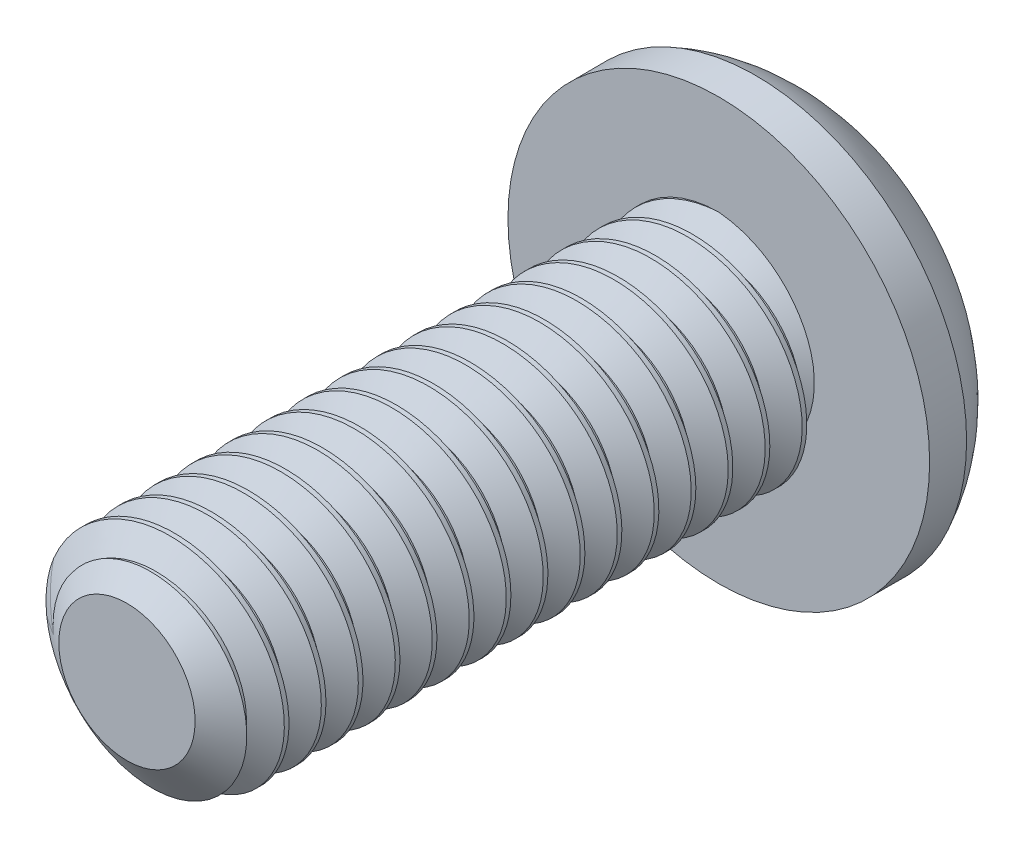
from build123d import *

# Parameters (mm, degrees)
SKETCH1_R          = 1.5
EXTRUDE1_DEPTH     = 8
CUT_SWEEP1_PITCH   = 0.5
SKETCH6_R          = 2.85
EXTRUDE2_DEPTH     = 1.65
CUT_EXTRUDE1_DEPTH = 1.5
SKETCH8_R          = 1.154700538
CUT_EXTRUDE2_DEPTH = 11.457891904
CUT_EXTRUDE2_TAPER = 45


with BuildPart() as part:
    # Sketch1 → Extrude1 (new body)
    with BuildSketch(Plane.XY):
        Circle(SKETCH1_R)
    extrude(amount=-EXTRUDE1_DEPTH)

    # Cut-Sweep1: the profile of Sketch3 profile screwed along a right-hand helix of 17 turns, 6 arcs to a turn; built about Z, then put on its axis
    cut_sweep1_z = Axis((0, 0, 0), (0, 0, 1))
    cut_sweep1_corners = [(1.5003, 0, -0.437673205), (1.175240474, 0, -0.25), (1.175240474, 0, -0.1875), (1.5003, 0, 0.000173205)]
    with BuildLine(mode=Mode.PRIVATE) as cut_sweep1_profile:
        Line(cut_sweep1_corners[0], cut_sweep1_corners[1])
        Line(cut_sweep1_corners[1], cut_sweep1_corners[2])
        Line(cut_sweep1_corners[2], cut_sweep1_corners[3])
        Line(cut_sweep1_corners[3], cut_sweep1_corners[0])
    cut_sweep1_cap = Face(cut_sweep1_profile.wire())
    cut_sweep1_turn_angles = [0, 30, 60, 90, 120, 150, 180, 210, 240, 270, 300, 330, 360]
    cut_sweep1_turn_weights = [1, 0.8660254037844387, 1, 0.8660254037844387, 1, 0.8660254037844387, 1, 0.8660254037844387, 1, 0.8660254037844387, 1, 0.8660254037844387, 1]
    cut_sweep1_turn_rails = [Edge.make_bspline([Vector(p[0], p[1], 0).rotate(cut_sweep1_z, cut_sweep1_turn_angles[k]) / cut_sweep1_turn_weights[k] + Vector(0, 0, p[2] + CUT_SWEEP1_PITCH * cut_sweep1_turn_angles[k] / 360) for k in range(13)], [0, 0, 0, 1, 1, 2, 2, 3, 3, 4, 4, 5, 5, 6, 6, 6], 2, cut_sweep1_turn_weights) for p in cut_sweep1_corners]
    cut_sweep1_turn_sides = [Face.make_surface_from_curves(cut_sweep1_turn_rails[p[0]], cut_sweep1_turn_rails[p[1]]) for p in [(0, 1), (1, 2), (2, 3), (3, 0)]]
    cut_sweep1 = Plane(origin=(0, 0, 0), x_dir=(0, 1, 0), z_dir=(0, 0, -1)) * Solid(Shell([*[p.moved(Location((0, 0, CUT_SWEEP1_PITCH * i))) for i in range(17) for p in cut_sweep1_turn_sides], cut_sweep1_cap, cut_sweep1_cap.rotate(cut_sweep1_z, 6120).moved(Location((0, 0, CUT_SWEEP1_PITCH * 6120 / 360)))]))
    add(cut_sweep1, mode=Mode.SUBTRACT)

    # Sketch4 → Cut-Revolve1 (revolve, cut)
    with BuildSketch(Plane(origin=(0, 0, 0), x_dir=(0, 0, -1), z_dir=(1, 0, 0)), mode=Mode.PRIVATE) as cut_revolve1_sk:
        Polygon((0.405251783, 1.5), (0, 0.921240474), (0, 1.5), align=None)
    revolve(cut_revolve1_sk.sketch.rotate(Axis((0, 0, 0), (0, 0, -1)), 263.352109169), axis=Axis((0, 0, 0), (0, 0, -1)), mode=Mode.SUBTRACT)

    # Sketch6 → Extrude2 (add)
    with BuildSketch(Plane(origin=(0, 0, -8), x_dir=(-1, 0, 0), z_dir=(0, 0, -1))):
        Circle(SKETCH6_R)
    extrude(amount=EXTRUDE2_DEPTH)

    # Sketch10 → Cut-Revolve2 (revolve, cut)
    with BuildSketch(Plane(origin=(0, 0, 0), x_dir=(0, 0, -1), z_dir=(1, 0, 0)), mode=Mode.PRIVATE) as cut_revolve2_sk:
        with BuildLine():
            Line((8.5, 2.85), (8.5, 3.35))
            Line((8.5, 3.35), (10.15, 3.35))
            Line((10.15, 3.35), (10.15, 1))
            Line((10.15, 1), (9.65, 1))
            ThreePointArc((9.65, 1), (9.339069073, 2.089151046), (8.5, 2.85))
        make_face()
    revolve(cut_revolve2_sk.sketch.rotate(Axis((0, 0, 0), (0, 0, -1)), 90), axis=Axis((0, 0, 0), (0, 0, -1)), mode=Mode.SUBTRACT)

    # Sketch7 → Cut-Extrude1 (cut)
    with BuildSketch(Plane(origin=(0, 0, -9.65), x_dir=(-1, 0, 0), z_dir=(0, 0, -1))):
        Polygon((0, 1.154700538), (-1, 0.577350269), (-1, -0.577350269), (0, -1.154700538), (1, -0.577350269), (1, 0.577350269), align=None)
    extrude(amount=-CUT_EXTRUDE1_DEPTH, mode=Mode.SUBTRACT)

    # Sketch8 → Cut-Extrude2 (cut, through all)
    with BuildSketch(Plane.XY.offset(-9.65)):
        Circle(SKETCH8_R)
    extrude(amount=CUT_EXTRUDE2_DEPTH, taper=CUT_EXTRUDE2_TAPER, mode=Mode.SUBTRACT)


solid = part.part
